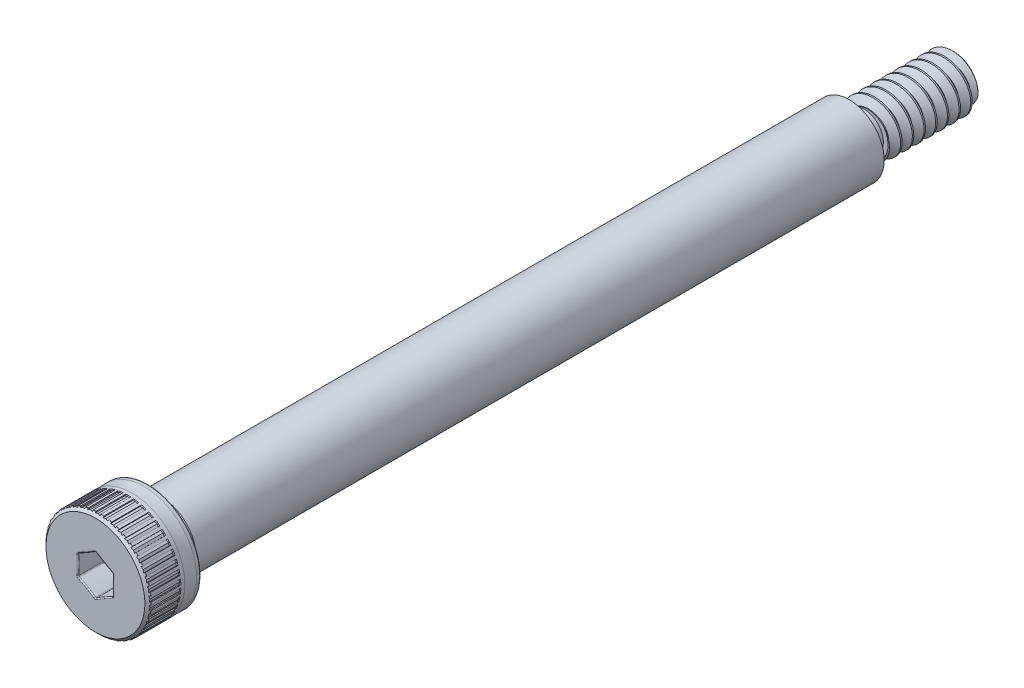
from build123d import *

# Parameters (mm, degrees)
SKETCH4_W             = 1.190625
SKETCH4_H             = 0.3175
SKETCH4_W_2           = 1.375833333
SKETCH4_H_2           = 0.687407664
CHAMFER1_SIZE         = 0.3175
FILLET1_R             = 0.1905
FILLET2_R             = 0.211666667
CHAMFER2_SIZE         = 0.264583333
CHAMFER3_SIZE         = 0.28575
CUT_EXTRUDE1_DEPTH    = 2.413
FILLET4_R             = 0.09525
DELETEFACE1_START     = -64.875833333
DELETEFACE1_OUTLINE_W = 6
DELETEFACE1_OUTLINE_H = 6
DELETEFACE1_OUTLINE_R = 1.725592336
DELETEFACE1_DEPTH     = 0.211666766
CUT_SWEEP1_PITCH      = 1.058333333
CUT_EXTRUDE2_REACH    = 80.079
CIRPATTERN1_COUNT     = 42
FILLET5_R             = 0.0508


# Read off the part's stored shape, not the designer's step: DeleteFace1, CirPattern2
with BuildPart() as part:
    # Sketch3 → Revolve1 (revolve)
    with BuildSketch(Plane(origin=(0, 0, 0), x_dir=(0, 0, -1), z_dir=(1, 0, 0)), mode=Mode.PRIVATE) as revolve1_sk:
        Polygon((-4.7625, 4.7625), (0, 4.7625), (0, 3.175), (63.5, 3.175), (63.5, 2.413), (73.025, 2.413), (73.025, 0), (-4.7625, 0), align=None)
    revolve(revolve1_sk.sketch.rotate(Axis((0, 0, 4.7625), (0, 0, -1)), 90), axis=Axis((0, 0, 4.7625), (0, 0, -1)))

    # Sketch4 → Cut-Revolve1 (revolve, cut)
    with BuildSketch(Plane(origin=(0, 0, 0), x_dir=(0, 0, -1), z_dir=(1, 0, 0)), mode=Mode.PRIVATE) as cut_revolve1_sk:
        with Locations((0.5953125, 3.01625)):
            Rectangle(SKETCH4_W, SKETCH4_H)
        with Locations((64.187916667, 2.069296168)):
            Rectangle(SKETCH4_W_2, SKETCH4_H_2)
    revolve(cut_revolve1_sk.sketch.rotate(Axis((0, 0, 4.7625), (0, 0, -1)), 90), axis=Axis((0, 0, 4.7625), (0, 0, -1)), mode=Mode.SUBTRACT)

    # Chamfer1
    chamfer1_edges = [part.edges().sort_by_distance(p)[0] for p in [
        (-2.8575, 0, -1.190625),
    ]]
    chamfer(chamfer1_edges, length=CHAMFER1_SIZE - 0.0001)  # a hair under: the kernel refuses the full size

    # Fillet1
    fillet1_edges = [part.edges().sort_by_distance(p)[0] for p in [
        (-2.8575, 0, 0),
    ]]
    fillet(fillet1_edges, radius=FILLET1_R)

    # Fillet2
    fillet2_edges = [part.edges().sort_by_distance(p)[0] for p in [
        (-1.725592336, 0, -63.5),
        (-1.725592336, 0, -64.875833333),
    ]]
    fillet(fillet2_edges, radius=FILLET2_R)

    # Chamfer2
    chamfer2_edges = [part.edges().sort_by_distance(p)[0] for p in [
        (-2.413, 0, -64.875833333),
        (-2.413, 0, -73.025),
    ]]
    chamfer(chamfer2_edges, length=CHAMFER2_SIZE)

    # Chamfer3
    chamfer3_edges = [part.edges().sort_by_distance(p)[0] for p in [
        (-4.7625, 0, 4.7625),
    ]]
    chamfer(chamfer3_edges, length=CHAMFER3_SIZE)

    # Sketch5 → Cut-Extrude1 (cut)
    with BuildSketch(Plane.XY.offset(4.7625)):
        with BuildLine():
            ThreePointArc((1.5875, 0.916543552), (0.777875, 1.347319022), (0, 1.833087105))
            ThreePointArc((0, 1.833087105), (-0.777875, 1.347319022), (-1.5875, 0.916543552))
            ThreePointArc((-1.5875, 0.916543552), (-1.55575, 0), (-1.5875, -0.916543552))
            ThreePointArc((-1.5875, -0.916543552), (-0.777875, -1.347319022), (0, -1.833087105))
            ThreePointArc((0, -1.833087105), (0.777875, -1.347319022), (1.5875, -0.916543552))
            ThreePointArc((1.5875, -0.916543552), (1.55575, 0), (1.5875, 0.916543552))
        make_face()
    extrude(amount=-CUT_EXTRUDE1_DEPTH, mode=Mode.SUBTRACT)

    # Fillet4
    fillet4_edges = [part.edges().sort_by_distance(p)[0] for p in [
        (1.55575, 0, 2.3495),
        (1.5875, 0.916543552, 3.556),
        (0.777875, -1.347319022, 2.3495),
        (1.5875, -0.916543552, 3.556),
        (-0.777875, -1.347319022, 2.3495),
        (0, -1.833087105, 3.556),
        (-1.55575, 0, 2.3495),
        (-1.5875, -0.916543552, 3.556),
        (-0.777875, 1.347319022, 2.3495),
        (-1.5875, 0.916543552, 3.556),
        (0.777875, 1.347319022, 2.3495),
        (0, 1.833087105, 3.556),
        (1.55575, 0, 4.7625),
        (0.777875, 1.347319022, 4.7625),
        (-0.777875, 1.347319022, 4.7625),
        (-1.55575, 0, 4.7625),
        (-0.777875, -1.347319022, 4.7625),
        (0.777875, -1.347319022, 4.7625),
        (-4.7625, 0, 0),
    ]]
    fillet(fillet4_edges, radius=FILLET4_R)

    # DeleteFace1 outline → DeleteFace1 (cut)
    with BuildSketch(Plane.XY.offset(DELETEFACE1_START)):
        Rectangle(DELETEFACE1_OUTLINE_W, DELETEFACE1_OUTLINE_H)
        Circle(DELETEFACE1_OUTLINE_R, mode=Mode.SUBTRACT)
    extrude(amount=DELETEFACE1_DEPTH, mode=Mode.SUBTRACT)

    # Cut-Sweep1: the profile of Sketch7 profile screwed along a right-hand helix of 8.48 turns, 8 arcs to a turn; built about Z, then put on its axis
    cut_sweep1_z = Axis((0, 0, 0), (0, 0, 1))
    cut_sweep1_corners = [(2.470283972, 0, 0.033072917), (2.470283972, 0, -0.959114583), (1.725292336, 0, -0.528993462), (1.725292336, 0, -0.397048205)]
    with BuildLine(mode=Mode.PRIVATE) as cut_sweep1_profile:
        Line(cut_sweep1_corners[0], cut_sweep1_corners[1])
        Line(cut_sweep1_corners[1], cut_sweep1_corners[2])
        Line(cut_sweep1_corners[2], cut_sweep1_corners[3])
        Line(cut_sweep1_corners[3], cut_sweep1_corners[0])
    cut_sweep1_cap = Face(cut_sweep1_profile.wire())
    cut_sweep1_turn_angles = [0, 22.5, 45, 67.5, 90, 112.5, 135, 157.5, 180, 202.5, 225, 247.5, 270, 292.5, 315, 337.5, 360]
    cut_sweep1_turn_weights = [1, 0.9238795325112867, 1, 0.9238795325112867, 1, 0.9238795325112867, 1, 0.9238795325112867, 1, 0.9238795325112867, 1, 0.9238795325112867, 1, 0.9238795325112867, 1, 0.9238795325112867, 1]
    cut_sweep1_turn_rails = [Edge.make_bspline([Vector(p[0], p[1], 0).rotate(cut_sweep1_z, cut_sweep1_turn_angles[k]) / cut_sweep1_turn_weights[k] + Vector(0, 0, p[2] + CUT_SWEEP1_PITCH * cut_sweep1_turn_angles[k] / 360) for k in range(17)], [0, 0, 0, 1, 1, 2, 2, 3, 3, 4, 4, 5, 5, 6, 6, 7, 7, 8, 8, 8], 2, cut_sweep1_turn_weights) for p in cut_sweep1_corners]
    cut_sweep1_turn_sides = [Face.make_surface_from_curves(cut_sweep1_turn_rails[p[0]], cut_sweep1_turn_rails[p[1]]) for p in [(0, 1), (1, 2), (2, 3), (3, 0)]]
    cut_sweep1_last_angles = [2880, 2902.5, 2925, 2947.5, 2970, 2992.5, 3015, 3033.9, 3052.8]
    cut_sweep1_last_weights = [1, 0.9238795325112867, 1, 0.9238795325112867, 1, 0.9238795325112867, 1, 0.9460853588275885, 1]
    cut_sweep1_last_rails = [Edge.make_bspline([Vector(p[0], p[1], 0).rotate(cut_sweep1_z, cut_sweep1_last_angles[k]) / cut_sweep1_last_weights[k] + Vector(0, 0, p[2] + CUT_SWEEP1_PITCH * cut_sweep1_last_angles[k] / 360) for k in range(9)], [0, 0, 0, 1, 1, 2, 2, 3, 3, 4, 4, 4], 2, cut_sweep1_last_weights) for p in cut_sweep1_corners]
    cut_sweep1_last_sides = [Face.make_surface_from_curves(cut_sweep1_last_rails[p[0]], cut_sweep1_last_rails[p[1]]) for p in [(0, 1), (1, 2), (2, 3), (3, 0)]]
    cut_sweep1 = Plane(origin=(0, 0, -73.025), x_dir=(0, 1, 0), z_dir=(0, 0, 1)) * Solid(Shell([*[p.moved(Location((0, 0, CUT_SWEEP1_PITCH * i))) for i in range(8) for p in cut_sweep1_turn_sides], *cut_sweep1_last_sides, cut_sweep1_cap, cut_sweep1_cap.rotate(cut_sweep1_z, 3052.8).moved(Location((0, 0, CUT_SWEEP1_PITCH * 3052.8 / 360)))]))
    add(cut_sweep1, mode=Mode.SUBTRACT)

    # Cut-Extrude2: up to this plane
    cut_extrude2_end = Plane(origin=(0, 5.814873764, 0.733563736), z_dir=(0, 0.707106781186546, 0.7071067811865491))
    # Sketch8 → Cut-Extrude2 (cut, up to the surface)
    with BuildSketch(Plane.XY.offset(4.7625), mode=Mode.PRIVATE) as cut_extrude2_sk1:
        Polygon((-0.2286, 4.7625), (0.2286, 4.7625), (0.218989269, 4.67106), (0, 4.71678), (-0.218989269, 4.67106), align=None)
    cut_extrude2_tool1 = split(extrude(cut_extrude2_sk1.sketch, amount=-CUT_EXTRUDE2_REACH, mode=Mode.PRIVATE), bisect_by=cut_extrude2_end, keep=Keep.BOTH, mode=Mode.PRIVATE)
    cut_extrude2 = cut_extrude2_tool1.solids().sort_by_distance((0, 4.727084, 4.7625))[0]
    add(cut_extrude2, mode=Mode.SUBTRACT)

    # CirPattern1: Cut-Extrude2 ×42 about axis
    cirpattern1_axis = Axis((0, 0, 0), (0, 0, 1))
    for i in range(1, CIRPATTERN1_COUNT):
        add(cut_extrude2.rotate(cirpattern1_axis, i * 360 / CIRPATTERN1_COUNT), mode=Mode.SUBTRACT)

    # Fillet5
    fillet5_edges = [part.edges().sort_by_distance(p)[0] for p in [
        (0.355902071, 4.749183084, 4.47675),
    ]]
    fillet(fillet5_edges, radius=FILLET5_R)

    # CirPattern2 outline → CirPattern2 (revolve, cut)
    with BuildSketch(Plane.XZ):
        with BuildLine():
            ThreePointArc((4.747621024, 4.491628976), (4.75863308, 4.47514827), (4.7625, 4.455707951))
            Line((4.7625, 4.455707951), (4.7625, 4.491628976))
            Line((4.7625, 4.491628976), (4.747621024, 4.491628976))
        make_face()
    revolve(axis=Axis((0, 0, 0), (0, 0, 1)), mode=Mode.SUBTRACT)

    # Sketch11 → Cut-Revolve6 (revolve, cut)
    with BuildSketch(Plane(origin=(0, 0, 0), x_dir=(0, 0, -1), z_dir=(1, 0, 0)), mode=Mode.PRIVATE) as cut_revolve6_sk:
        with BuildLine():
            Line((-1.42875, 4.7625), (-0.3571875, 4.7625))
            ThreePointArc((-0.3571875, 4.7625), (-0.89296875, 4.74472), (-1.42875, 4.7625))
        make_face()
    revolve(cut_revolve6_sk.sketch.rotate(Axis((0, 0, 4.7625), (0, 0, -1)), 90), axis=Axis((0, 0, 4.7625), (0, 0, -1)), mode=Mode.SUBTRACT)


solid = part.part
